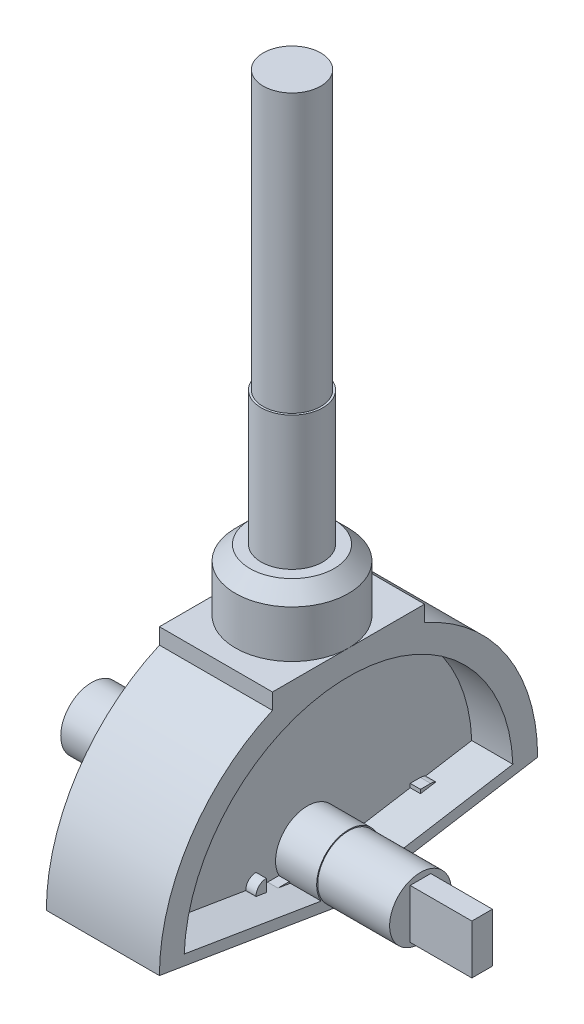
from build123d import *

# Parameters (mm, degrees)
EXTRUDE_1_DEPTH     = 5.5
CUT_EXTRUDE_START   = -2
CUT_EXTRUDE_1_DEPTH = 2
CUT_EXTRUDE_2_DEPTH = 2
EXTRUDE_2_DEPTH     = 5.5
SKETCH_5_R          = 2.75
EXTRUDE_3_DEPTH     = 3
CHAMFER_1_SIZE      = 0.7
SKETCH_6_R          = 1.5
EXTRUDE_4_DEPTH     = 20
SKETCH_7_R          = 1.5
EXTRUDE_5_DEPTH     = 7
EXTRUDE_START       = 3.5
SKETCH_8_R          = 1.5
EXTRUDE_6_DEPTH     = 3.5
EXTRUDE_7_DEPTH     = 3
EXTRUDE_8_DEPTH     = 7.5
EXTRUDE_9_DEPTH     = 6
SKETCH_12_R         = 2.369511938
SKETCH_12_R_2       = 1.4
CUT_EXTRUDE_3_DEPTH = 13.5


with BuildPart() as part:
    # 草图1 → 凸台-拉伸1 (new body)
    with BuildSketch(Plane(origin=(0, 0, 0), x_dir=(0, 0, -1), z_dir=(1, 0, 0))):
        with BuildLine():
            Line((-9.2, 0), (-0.630158831, -1.41612141))
            ThreePointArc((-0.630158831, -1.41612141), (0, -1.55), (0.630158831, -1.41612141))
            Line((0.630158831, -1.41612141), (9.2, 0))
            ThreePointArc((9.2, 0), (0, 9.2), (-9.2, 0))
        make_face()
    extrude(amount=EXTRUDE_1_DEPTH)

    # 草图2 → 切除-拉伸1 (cut)
    with BuildSketch(Plane(origin=(5.5, 0, 0), x_dir=(0, 0, -1), z_dir=(1, 0, 0)).offset(CUT_EXTRUDE_START)):
        with BuildLine():
            Line((-7.994087674, 0.307509782), (-1.331520023, -0.79344466))
            ThreePointArc((-1.331520023, -0.79344466), (0, 1.55), (1.331520023, -0.79344466))
            Line((1.331520023, -0.79344466), (7.994087674, 0.307509782))
            ThreePointArc((7.994087674, 0.307509782), (0, 8), (-7.994087674, 0.307509782))
        make_face()
    extrude(amount=CUT_EXTRUDE_1_DEPTH, mode=Mode.SUBTRACT)

    # 草图3 → 切除-拉伸2 (cut)
    with BuildSketch(Plane.ZY):
        with BuildLine():
            Line((-1.331520023, -0.79344466), (-7.994087674, 0.307509782))
            ThreePointArc((-7.994087674, 0.307509782), (0, 8), (7.994087674, 0.307509782))
            Line((7.994087674, 0.307509782), (1.331520023, -0.79344466))
            ThreePointArc((1.331520023, -0.79344466), (0, 1.55), (-1.331520023, -0.79344466))
        make_face()
    extrude(amount=-CUT_EXTRUDE_2_DEPTH, mode=Mode.SUBTRACT)

    # 草图4 → 凸台-拉伸2 (add)
    with BuildSketch(Plane.ZY):
        Polygon((0, 9.2), (-3.7, 9.2), (-3.7, 8.423182296), (3.7, 8.423182296), (3.7, 9.2), align=None)
    extrude(amount=-EXTRUDE_2_DEPTH)

    # 草图5 → 凸台-拉伸3 (add)
    with BuildSketch(Plane(origin=(0, 9.2, 0), x_dir=(1, 0, 0), z_dir=(0, 1, 0))):
        with Locations((2.75, 0)):
            Circle(SKETCH_5_R)
    extrude(amount=EXTRUDE_3_DEPTH)

    # Chamfer 1
    chamfer_1_edges = [part.edges().sort_by_distance(p)[0] for p in [
        (0, 12.2, 0),
    ]]
    chamfer(chamfer_1_edges, length=CHAMFER_1_SIZE)

    # 草图6 → 凸台-拉伸4 (add)
    with BuildSketch(Plane(origin=(0, 12.2, 0), x_dir=(1, 0, 0), z_dir=(0, 1, 0))):
        with Locations((2.75, 0)):
            Circle(SKETCH_6_R)
    extrude(amount=EXTRUDE_4_DEPTH)

    # 草图7 → 凸台-拉伸5 (add)
    with BuildSketch(Plane.ZY):
        Circle(SKETCH_7_R)
    extrude(amount=EXTRUDE_5_DEPTH)

    # 草图8 → 凸台-拉伸6 (add)
    with BuildSketch(Plane(origin=(5.5, 0, 0), x_dir=(0, 0, -1), z_dir=(1, 0, 0)).offset(EXTRUDE_START)):
        Circle(SKETCH_8_R)
    extrude(amount=-EXTRUDE_6_DEPTH)

    # 草图9 → 凸台-拉伸7 (add)
    with BuildSketch(Plane(origin=(9, 0, 0), x_dir=(0, 0, -1), z_dir=(1, 0, 0))):
        Polygon((0, 1.2), (0.5, 1.2), (0.5, -1.2), (-0.5, -1.2), (-0.5, 1.2), align=None)
    extrude(amount=EXTRUDE_7_DEPTH)

    # 草图10 → 凸台-拉伸8 (add)
    with BuildSketch(Plane(origin=(4, 0, 0), x_dir=(0, 0, -1), z_dir=(1, 0, 0))):
        with BuildLine():
            Line((5.5, 0), (5, 0))
            Line((5, 0), (5, -0.694028023))
            Line((5, -0.694028023), (-2.5, -0.694028023))
            Line((-2.5, -0.694028023), (-2.5, 0))
            ThreePointArc((-2.5, 0), (-2.853553391, -0.146446609), (-3, -0.5))
            Line((-3, -0.5), (-3, -1.5))
            ThreePointArc((-3, -1.5), (-2.853553391, -1.853553391), (-2.5, -2))
            Line((-2.5, -2), (0, -2))
            Line((0, -2), (5.5, -2))
            ThreePointArc((5.5, -2), (5.853553391, -1.853553391), (6, -1.5))
            Line((6, -1.5), (6, -0.5))
            ThreePointArc((6, -0.5), (5.853553391, -0.146446609), (5.5, 0))
        make_face()
    extrude(amount=-EXTRUDE_8_DEPTH)

    # 草图11 → 凸台-拉伸9 (add)
    with BuildSketch(Plane.ZY.offset(-2)):
        with BuildLine():
            Line((-1.5, 0), (-1.5, 1.322875656))
            ThreePointArc((-1.5, 1.322875656), (0, 2), (1.5, 1.322875656))
            Line((1.5, 1.322875656), (1.599468005, -1.200709))
            ThreePointArc((1.599468005, -1.200709), (0.078769562, -1.998448237), (-1.5, -1.322875656))
            Line((-1.5, -1.322875656), (-1.5, 0))
        make_face()
    extrude(amount=EXTRUDE_9_DEPTH)

    # 草图12 → 切除-拉伸3 (cut)
    with BuildSketch(Plane(origin=(0, 32.2, 0), x_dir=(1, 0, 0), z_dir=(0, 1, 0))):
        with Locations((2.75, 0)):
            Circle(SKETCH_12_R)
        with Locations((2.75, 0)):
            Circle(SKETCH_12_R_2, mode=Mode.SUBTRACT)
    extrude(amount=-CUT_EXTRUDE_3_DEPTH, mode=Mode.SUBTRACT)


solid = part.part
